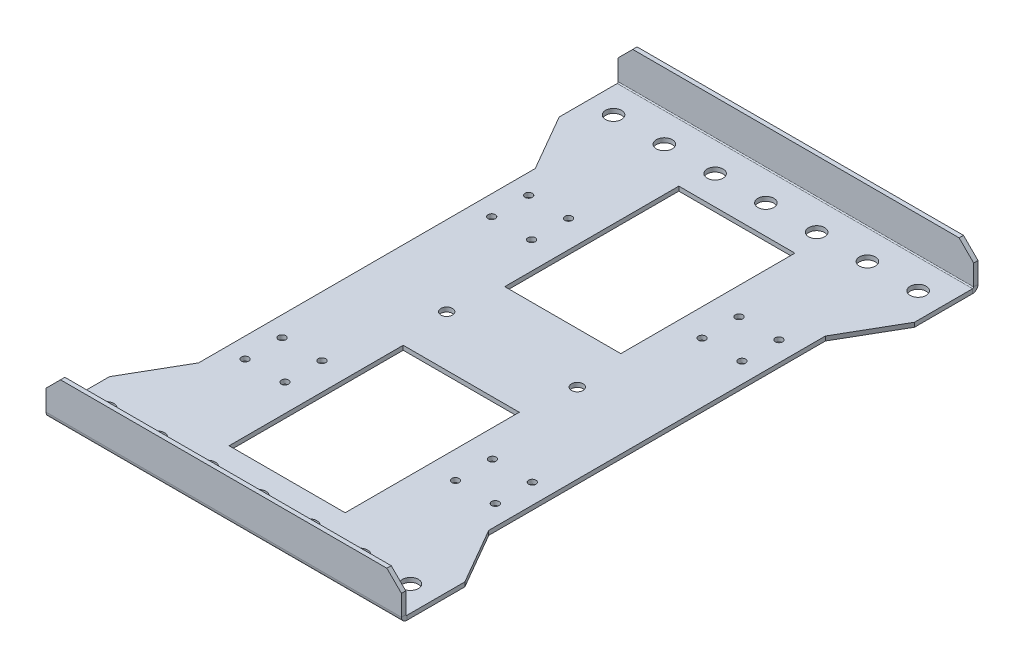
from build123d import *

# Parameters (mm, degrees)
CROQUIS1_W                  = 245
CROQUIS1_H                  = 390
BRIDA_BASE1_DEPTH           = 3
BRIDA_DE_ARISTA1_DEPTH      = 245
BRIDA_DE_ARISTA1_BEND_DEPTH = 245
CROQUIS12_W                 = 80
CROQUIS12_H                 = 120
CORTAR_EXTRUIR1_DEPTH       = 3
CROQUIS13_R                 = 2.5
CORTAR_EXTRUIR2_DEPTH       = 3
CHAFL_N1_SIZE               = 10
CROQUIS14_R                 = 5.5
CORTAR_EXTRUIR3_DEPTH       = 3
CROQUIS15_R                 = 4
CORTAR_EXTRUIR4_DEPTH       = 3


# Sheet-metal steps are written as plain solids
with BuildPart() as part:
    # Croquis1 → Brida base1 (new body)
    with BuildSketch(Plane(origin=(0, 0, 0), x_dir=(1, 0, 0), z_dir=(0, 1, 0))):
        Rectangle(CROQUIS1_W, CROQUIS1_H)
    extrude(amount=-BRIDA_BASE1_DEPTH)

    # Brida de arista1 section (across the edge) → Brida de arista1 (add)
    with BuildSketch(Plane(origin=(122.5, 0, -195.7366), x_dir=(0, 0, 1), z_dir=(-1, 0, 0))):
        with BuildLine():
            Line((-3, 0.7366), (-3, 25))
            Line((-3, 25), (0, 25))
            Line((0, 25), (0, 0.7366))
            ThreePointArc((0, 0.7366), (0.215745145, 0.215745145), (0.7366, 0))
            Line((0.7366, 0), (0.7366, -3))
            ThreePointArc((0.7366, -3), (-1.905575199, -1.905575199), (-3, 0.7366))
        make_face()
    extrude(amount=BRIDA_DE_ARISTA1_DEPTH)

    # Brida de arista1 section 2 (across the edge) → Brida de arista1 bend (add)
    with BuildSketch(Plane(origin=(-122.5, 0, 195.7366), x_dir=(0, 0, -1), z_dir=(1, 0, 0))):
        with BuildLine():
            Line((-3, 0.7366), (-3, 25))
            Line((-3, 25), (0, 25))
            Line((0, 25), (0, 0.7366))
            ThreePointArc((0, 0.7366), (0.215745145, 0.215745145), (0.7366, 0))
            Line((0.7366, 0), (0.7366, -3))
            ThreePointArc((0.7366, -3), (-1.905575199, -1.905575199), (-3, 0.7366))
        make_face()
    extrude(amount=BRIDA_DE_ARISTA1_BEND_DEPTH)

    # Croquis12 → Cortar-Extruir1 (cut)
    with BuildSketch(Plane(origin=(0, 0, 0), x_dir=(1, 0, 0), z_dir=(0, 1, 0))):
        Polygon((-122.5, 155), (-122.5, -155), (-100, -116.02885683), (-100, 0), (-100, 116.02885683), align=None)
        with Locations((0, -95)):
            Rectangle(CROQUIS12_W, CROQUIS12_H)
        Polygon((100, -116.02885683), (122.5, -155), (122.5, 155), (100, 116.02885683), (100, 0), align=None)
        with Locations((0, 95)):
            Rectangle(CROQUIS12_W, CROQUIS12_H)
    extrude(amount=-CORTAR_EXTRUIR1_DEPTH, mode=Mode.SUBTRACT)

    # Croquis13 → Cortar-Extruir2 (cut)
    with BuildSketch(Plane(origin=(0, 0, 0), x_dir=(1, 0, 0), z_dir=(0, 1, 0))):
        with Locations(Location((-86.25, 97.75, 0), (0, 0, 270))):
            Circle(CROQUIS13_R)
        with Locations(Location((-58.75, 97.75, 0), (0, 0, 270))):
            Circle(CROQUIS13_R)
        with Locations(Location((-86.25, 72.25, 0), (0, 0, 270))):
            Circle(CROQUIS13_R)
        with Locations(Location((-58.75, 72.25, 0), (0, 0, 270))):
            Circle(CROQUIS13_R)
        with Locations(Location((86.25, 72.25, 0), (0, 0, 270))):
            Circle(CROQUIS13_R)
        with Locations(Location((58.75, 72.25, 0), (0, 0, 270))):
            Circle(CROQUIS13_R)
        with Locations(Location((58.75, 97.75, 0), (0, 0, 270))):
            Circle(CROQUIS13_R)
        with Locations(Location((86.25, 97.75, 0), (0, 0, 270))):
            Circle(CROQUIS13_R)
        with Locations(Location((86.25, -72.25, 0), (0, 0, 270))):
            Circle(CROQUIS13_R)
        with Locations(Location((58.75, -72.25, 0), (0, 0, 270))):
            Circle(CROQUIS13_R)
        with Locations(Location((86.25, -97.75, 0), (0, 0, 270))):
            Circle(CROQUIS13_R)
        with Locations(Location((58.75, -97.75, 0), (0, 0, 270))):
            Circle(CROQUIS13_R)
        with Locations(Location((-58.75, -72.25, 0), (0, 0, 270))):
            Circle(CROQUIS13_R)
        with Locations(Location((-58.75, -97.75, 0), (0, 0, 270))):
            Circle(CROQUIS13_R)
        with Locations(Location((-86.25, -97.75, 0), (0, 0, 270))):
            Circle(CROQUIS13_R)
        with Locations(Location((-86.25, -72.25, 0), (0, 0, 270))):
            Circle(CROQUIS13_R)
    extrude(amount=-CORTAR_EXTRUIR2_DEPTH, mode=Mode.SUBTRACT)

    # Chaflán1
    chafl_n1_edges = [part.edges().sort_by_distance(p)[0] for p in [
        (122.5, 25, -197.2366),
        (-122.5, 25, -197.2366),
        (-122.5, 25, 197.2366),
        (122.5, 25, 197.2366),
    ]]
    chamfer(chafl_n1_edges, length=CHAFL_N1_SIZE)

    # Croquis14 → Cortar-Extruir3 (cut)
    with BuildSketch(Plane(origin=(0, 0, 0), x_dir=(1, 0, 0), z_dir=(0, 1, 0))):
        with Locations(Location((-105, 175, 0), (0, 0, 270))):
            Circle(CROQUIS14_R)
        with Locations(Location((-70, 175, 0), (0, 0, 270))):
            Circle(CROQUIS14_R)
        with Locations(Location((-35, 175, 0), (0, 0, 270))):
            Circle(CROQUIS14_R)
        with Locations(Location((0, 175, 0), (0, 0, 270))):
            Circle(CROQUIS14_R)
        with Locations(Location((35, 175, 0), (0, 0, 270))):
            Circle(CROQUIS14_R)
        with Locations(Location((70, 175, 0), (0, 0, 270))):
            Circle(CROQUIS14_R)
        with Locations(Location((105, 175, 0), (0, 0, 270))):
            Circle(CROQUIS14_R)
        with Locations(Location((105, -175, 0), (0, 0, 90))):
            Circle(CROQUIS14_R)
        with Locations(Location((70, -175, 0), (0, 0, 90))):
            Circle(CROQUIS14_R)
        with Locations(Location((35, -175, 0), (0, 0, 90))):
            Circle(CROQUIS14_R)
        with Locations(Location((0, -175, 0), (0, 0, 90))):
            Circle(CROQUIS14_R)
        with Locations(Location((-35, -175, 0), (0, 0, 90))):
            Circle(CROQUIS14_R)
        with Locations(Location((-70, -175, 0), (0, 0, 90))):
            Circle(CROQUIS14_R)
        with Locations(Location((-105, -175, 0), (0, 0, 90))):
            Circle(CROQUIS14_R)
    extrude(amount=-CORTAR_EXTRUIR3_DEPTH, mode=Mode.SUBTRACT)

    # Croquis15 → Cortar-Extruir4 (cut)
    with BuildSketch(Plane.XZ.offset(3)):
        with Locations(Location((45, 0, 0), (0, 0, 270))):
            Circle(CROQUIS15_R)
        with Locations(Location((-45, 0, 0), (0, 0, 270))):
            Circle(CROQUIS15_R)
    extrude(amount=-CORTAR_EXTRUIR4_DEPTH, mode=Mode.SUBTRACT)


solid = part.part
